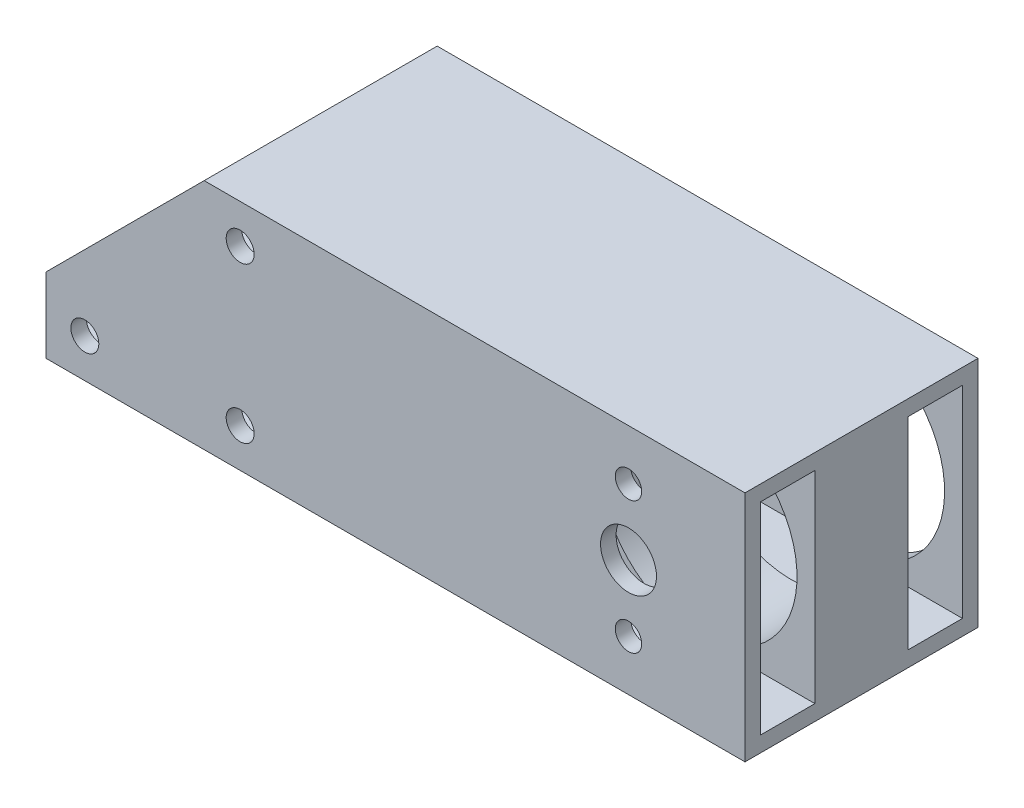
from build123d import *

# Parameters (mm, degrees)
SKETCH1_W               = 30
SKETCH1_H               = 30
SKETCH1_W_2             = 7
SKETCH1_H_2             = 26
BOSS_EXTRUDE3_DEPTH     = 90
SKETCH6_R               = 12.7
CUT_EXTRUDE5_DEPTH      = 23
SKETCH8_R               = 3.6
SKETCH8_R_2             = 1.7
CUT_EXTRUDE6_DEPTH      = 17
SKETCH9_W               = 12
SKETCH9_H               = 26
CUT_EXTRUDE7_DEPTH      = 59
M3_CLEARANCE_HOLE1_D    = 3.6
CUT_EXTRUDE8_DEPTH      = 28
CUT_EXTRUDE8_DEPTH_BACK = 26


with BuildPart() as part:
    # Sketch1 → Boss-Extrude3 (new body)
    with BuildSketch(Plane(origin=(0, 0, 0), x_dir=(0, 0, -1), z_dir=(1, 0, 0))):
        Rectangle(SKETCH1_W, SKETCH1_H)
        with Locations((-9.5, 0)):
            Rectangle(SKETCH1_W_2, SKETCH1_H_2, mode=Mode.SUBTRACT)
        with Locations((9.5, 0)):
            Rectangle(SKETCH1_W_2, SKETCH1_H_2, mode=Mode.SUBTRACT)
    extrude(amount=BOSS_EXTRUDE3_DEPTH)

    # Sketch6 → Cut-Extrude5 (cut)
    with BuildSketch(Plane(origin=(0, 0, -15), x_dir=(-1, 0, 0), z_dir=(0, 0, -1))):
        with Locations((-75, 0)):
            Circle(SKETCH6_R)
    extrude(amount=-CUT_EXTRUDE5_DEPTH, mode=Mode.SUBTRACT)

    # Sketch8 → Cut-Extrude6 (cut)
    with BuildSketch(Plane.XY.offset(15)):
        with Locations((75, 0)):
            Circle(SKETCH8_R)
        with Locations((75, 8.5)):
            Circle(SKETCH8_R_2)
        with Locations((75, -8.5)):
            Circle(SKETCH8_R_2)
    extrude(amount=-CUT_EXTRUDE6_DEPTH, mode=Mode.SUBTRACT)

    # Sketch9 → Cut-Extrude7 (cut)
    with BuildSketch(Plane.ZY):
        Rectangle(SKETCH9_W, SKETCH9_H)
    extrude(amount=-CUT_EXTRUDE7_DEPTH, mode=Mode.SUBTRACT)

    # M3 Clearance Hole1 (through all)
    with Locations(Plane.XY.offset(15)):
        with Locations((25, 10), (5, -10), (25, -10), (5, 10)):
            Hole(M3_CLEARANCE_HOLE1_D / 2)

    # Sketch13 → Cut-Extrude8 (cut, two sides: drawn at the far end of the back side and taken through both)
    with BuildSketch(Plane.XY.offset(-CUT_EXTRUDE8_DEPTH_BACK)):
        Polygon((0, -5.364675298), (20.364675298, 15), (0, 15), align=None)
    extrude(amount=CUT_EXTRUDE8_DEPTH + CUT_EXTRUDE8_DEPTH_BACK, mode=Mode.SUBTRACT)


solid = part.part
